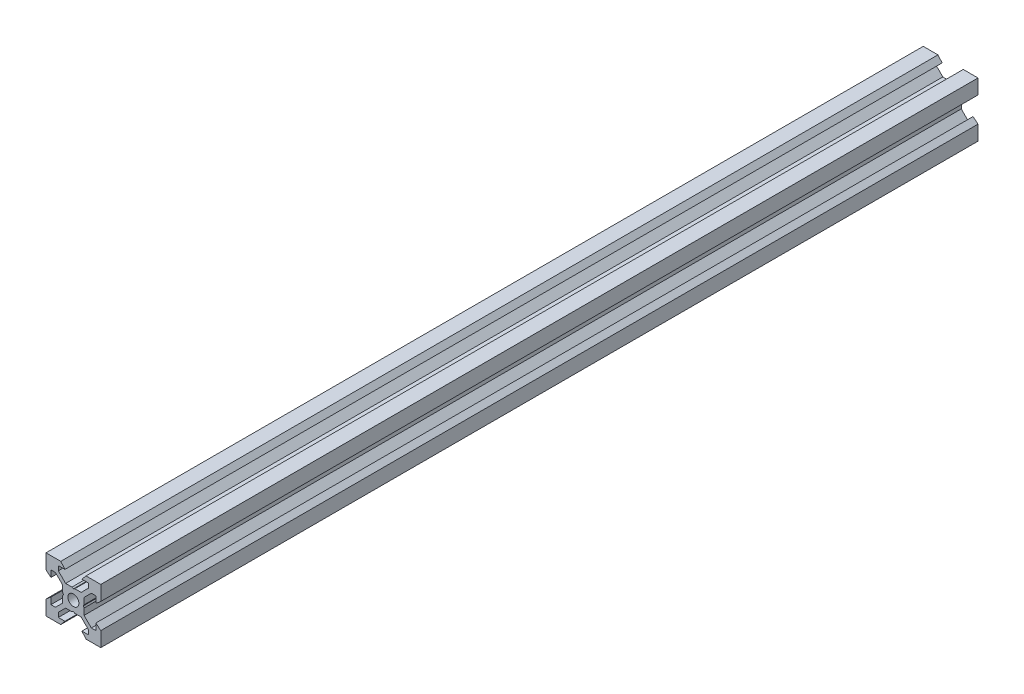
from build123d import *

# Parameters (mm, degrees)
SKETCH1_R           = 2
BOSS_EXTRUDE1_DEPTH = 160.165


with BuildPart() as part:
    # Sketch1 → Boss-Extrude1 (new, symmetric)
    with BuildSketch(Plane.XY):
        Polygon((10, 4.610379336), (10, 10), (4.610379336, 10), (3.1, 8.2), (5.5, 8.2), (5.5, 6.560660172), (2.839339828, 3.9), (0.519615242, 3.9), (0, 3.6), (-0.519615242, 3.9), (-2.839339828, 3.9), (-5.5, 6.560660172), (-5.5, 8.2), (-3.1, 8.2), (-4.610379336, 10), (-10, 10), (-10, 4.610379336), (-8.2, 3.1), (-8.2, 5.5), (-6.560660172, 5.5), (-3.9, 2.839339828), (-3.9, 0.519615242), (-3.6, 0), (-3.9, -0.519615242), (-3.9, -2.839339828), (-6.560660172, -5.5), (-8.2, -5.5), (-8.2, -3.1), (-10, -4.610379336), (-10, -10), (-4.610379336, -10), (-3.1, -8.2), (-5.5, -8.2), (-5.5, -6.560660172), (-2.839339828, -3.9), (-0.519615242, -3.9), (0, -3.6), (0.519615242, -3.9), (2.839339828, -3.9), (5.5, -6.560660172), (5.5, -8.2), (3.1, -8.2), (4.610379336, -10), (10, -10), (10, -4.610379336), (8.2, -3.1), (8.2, -5.5), (6.560660172, -5.5), (3.9, -2.839339828), (3.9, -0.519615242), (3.6, 0), (3.9, 0.519615242), (3.9, 2.839339828), (6.560660172, 5.5), (8.2, 5.5), (8.2, 3.1), align=None)
        Circle(SKETCH1_R, mode=Mode.SUBTRACT)
    extrude(amount=BOSS_EXTRUDE1_DEPTH, both=True)


solid = part.part
